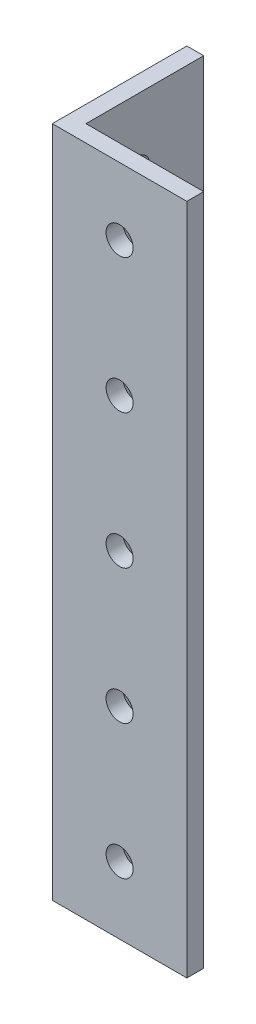
from build123d import *

# Parameters (mm, degrees)
BOSS_EXTRUDE1_DEPTH = 127
SKETCH3_R           = 2.5527
CUT_EXTRUDE1_DEPTH  = 132.313369351
LPATTERN1_COUNT     = 5
LPATTERN1_PITCH     = 25.4
SKETCH4_R           = 2.5527
CUT_EXTRUDE2_DEPTH  = 131.568470743
LPATTERN2_COUNT     = 5
LPATTERN2_PITCH     = 25.4


with BuildPart() as part:
    # Sketch2 → Boss-Extrude1 (new body)
    with BuildSketch(Plane(origin=(0, 0, 0), x_dir=(1, 0, 0), z_dir=(0, 1, 0))):
        Polygon((-20.619770297, 24.904825743), (-20.619770297, -0.495174257), (4.780229703, -0.495174257), (4.780229703, 2.679825743), (-17.444770297, 2.679825743), (-17.444770297, 24.904825743), align=None)
    extrude(amount=BOSS_EXTRUDE1_DEPTH)

    # Sketch3 → Cut-Extrude1 (cut, through all)
    with BuildSketch(Plane(origin=(-17.444770297, 0, 0), x_dir=(0, 0, -1), z_dir=(1, 0, 0))):
        with Locations((12.204825743, 12.7)):
            Circle(SKETCH3_R)
    cut_extrude1 = extrude(amount=-CUT_EXTRUDE1_DEPTH, mode=Mode.SUBTRACT)

    # LPattern1: Cut-Extrude1 ×5
    with Locations(*[(0, i * LPATTERN1_PITCH, 0) for i in range(1, LPATTERN1_COUNT)]):
        add(cut_extrude1, mode=Mode.SUBTRACT)

    # Sketch4 → Cut-Extrude2 (cut, through all)
    with BuildSketch(Plane(origin=(0, 0, -2.679825743), x_dir=(-1, 0, 0), z_dir=(0, 0, -1))):
        with Locations((7.919770297, 12.7)):
            Circle(SKETCH4_R)
    cut_extrude2 = extrude(amount=-CUT_EXTRUDE2_DEPTH, mode=Mode.SUBTRACT)

    # LPattern2: Cut-Extrude2 ×5
    with Locations(*[(0, i * LPATTERN2_PITCH, 0) for i in range(1, LPATTERN2_COUNT)]):
        add(cut_extrude2, mode=Mode.SUBTRACT)


solid = part.part
